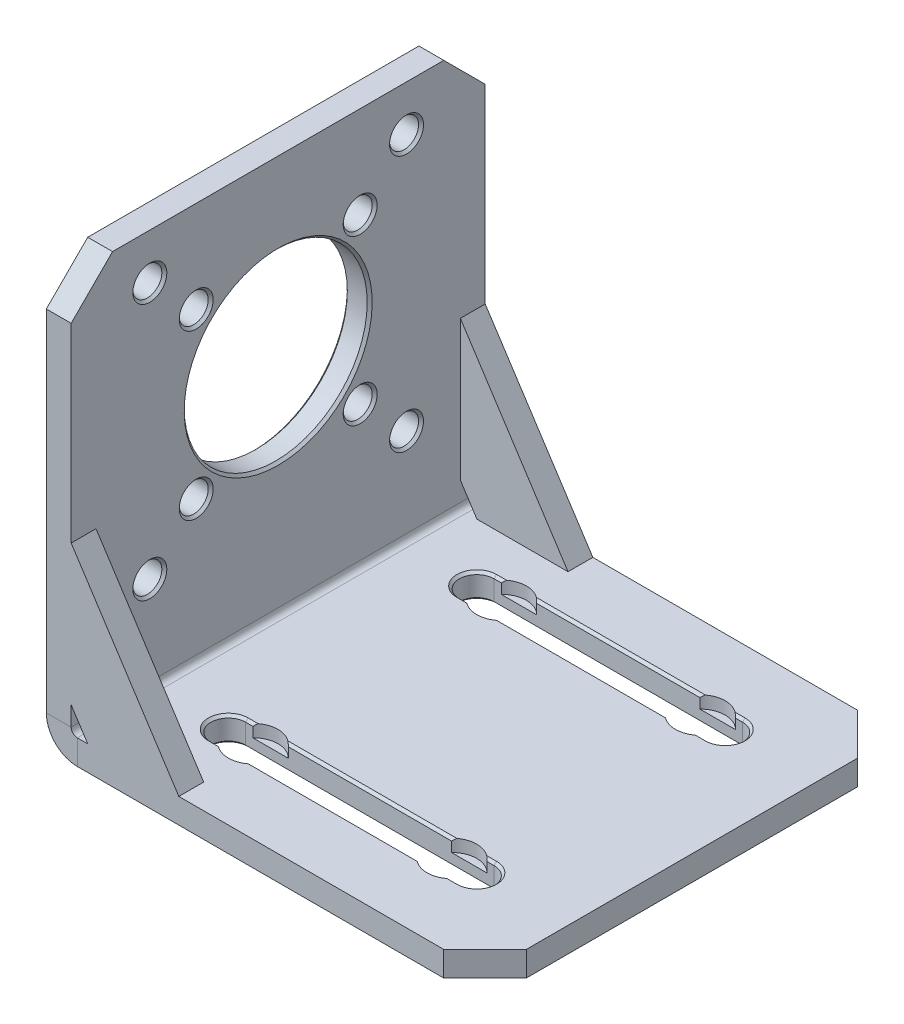
from build123d import *

# Parameters (mm, degrees)
SKETCH1_W                    = 100
SKETCH1_H                    = 50
BASE_FLANGE1_DEPTH           = 3
SKETCH2_R                    = 11.05
SKETCH2_R_2                  = 1.75
CUT_EXTRUDE1_DEPTH           = 104.121287812
SKETCH3_R                    = 1.75
CUT_EXTRUDE2_DEPTH           = 104.121287812
CIRPATTERN1_COUNT            = 4
CUT_EXTRUDE3_DEPTH           = 104.121287812
SKETCHED_BEND2_OUTLINE_W     = 3
SKETCHED_BEND2_OUTLINE_H     = 50
SKETCHED_BEND2_DEPTH         = 47.020021532
SKETCHED_START               = 47.383443248
SKETCHED_BEND2_2_OUTLINE_W   = 47.979978468
SKETCHED_BEND2_2_OUTLINE_H   = 50
SKETCHED_BEND2_2_OUTLINE_R   = 1.75
SKETCHED_BEND2_2_OUTLINE_R_2 = 11.05
SKETCHED_BEND2_2_DEPTH       = 2.636578284
SKETCHED_START_2             = 47.020021532
SKETCHED_BEND2_3_OUTLINE_W   = 47.979978468
SKETCHED_BEND2_3_OUTLINE_H   = 50
SKETCHED_BEND2_3_OUTLINE_R   = 1.75
SKETCHED_BEND2_3_OUTLINE_R_2 = 11.05
SKETCHED_BEND2_3_DEPTH       = 3.7366
SKETCHED_START_3             = -26
SKETCHED_BEND2_4_DEPTH       = 52
BOSS_EXTRUDE1_DEPTH          = 3
CHAMFER1_SIZE                = 5
CHAMFER2_SIZE                = 0.3
CHAMFER3_SIZE                = 0.3
SKETCH7_R                    = 3
CUT_EXTRUDE4_DEPTH           = 1.5


with BuildPart() as part:
    # Base-Flange1: sheet metal written as solids
    # Sketch1 → Base-Flange1 (new body)
    with BuildSketch(Plane(origin=(0, 0, 0), x_dir=(1, 0, 0), z_dir=(0, 1, 0))):
        with Locations((50, 0)):
            Rectangle(SKETCH1_W, SKETCH1_H)
    extrude(amount=-BASE_FLANGE1_DEPTH)

    # Sketch2 → Cut-Extrude1 (cut, through all)
    with BuildSketch(Plane(origin=(0, 0, 0), x_dir=(1, 0, 0), z_dir=(0, 1, 0))):
        with Locations(Location((21, 0, 0), (0, 0, 270))):
            Circle(SKETCH2_R)
        with Locations(Location((5.5, 15.5, 0), (0, 0, 270))):
            Circle(SKETCH2_R_2)
        with Locations(Location((36.5, 15.5, 0), (0, 0, 270))):
            Circle(SKETCH2_R_2)
        with Locations(Location((36.5, -15.5, 0), (0, 0, 270))):
            Circle(SKETCH2_R_2)
        with Locations(Location((5.5, -15.5, 0), (0, 0, 270))):
            Circle(SKETCH2_R_2)
    extrude(amount=-CUT_EXTRUDE1_DEPTH, mode=Mode.SUBTRACT)

    # Sketch3 → Cut-Extrude2 (cut, through all)
    with BuildSketch(Plane(origin=(0, 0, 0), x_dir=(1, 0, 0), z_dir=(0, 1, 0))):
        with Locations(Location((11.100505063, 9.899494937, 0), (0, 0, 270))):
            Circle(SKETCH3_R)
    cut_extrude2 = extrude(amount=-CUT_EXTRUDE2_DEPTH, mode=Mode.SUBTRACT)

    # CirPattern1: Cut-Extrude2 ×4 about axis
    cirpattern1_axis = Axis((21, 0, 0), (0, 1, 0))
    for i in range(1, CIRPATTERN1_COUNT):
        add(cut_extrude2.rotate(cirpattern1_axis, i * 360 / CIRPATTERN1_COUNT), mode=Mode.SUBTRACT)

    # Sketch4 → Cut-Extrude3 (cut, through all)
    with BuildSketch(Plane(origin=(0, 0, 0), x_dir=(1, 0, 0), z_dir=(0, 1, 0))):
        with BuildLine():
            Line((59, 17.1), (89, 17.1))
            ThreePointArc((89, 17.1), (91.1, 15), (89, 12.9))
            Line((89, 12.9), (59, 12.9))
            ThreePointArc((59, 12.9), (56.9, 15), (59, 17.1))
        make_face()
        with BuildLine():
            Line((59, -12.9), (89, -12.9))
            ThreePointArc((89, -12.9), (91.1, -15), (89, -17.1))
            Line((89, -17.1), (59, -17.1))
            ThreePointArc((59, -17.1), (56.9, -15), (59, -12.9))
        make_face()
    extrude(amount=-CUT_EXTRUDE3_DEPTH, mode=Mode.SUBTRACT)

    # Sketched Bend2: read off the stored shape, not the designer's step
    # Sketched Bend2 outline → Sketched Bend2 (cut)
    with BuildSketch(Plane.YZ):
        with Locations((-1.5, 0)):
            Rectangle(SKETCHED_BEND2_OUTLINE_W, SKETCHED_BEND2_OUTLINE_H)
    extrude(amount=SKETCHED_BEND2_DEPTH, mode=Mode.SUBTRACT)

    # Sketched Bend2 2 outline → Sketched Bend2 2 (add)
    with BuildSketch(Plane.YZ.offset(SKETCHED_START)):
        with Locations((23.989989234, 0)):
            Rectangle(SKETCHED_BEND2_2_OUTLINE_W, SKETCHED_BEND2_2_OUTLINE_H)
        with Locations((11.479978468, -15.5)):
            Circle(SKETCHED_BEND2_2_OUTLINE_R, mode=Mode.SUBTRACT)
        with Locations((17.080483531, -9.899494937)):
            Circle(SKETCHED_BEND2_2_OUTLINE_R, mode=Mode.SUBTRACT)
        with Locations((42.479978468, -15.5)):
            Circle(SKETCHED_BEND2_2_OUTLINE_R, mode=Mode.SUBTRACT)
        with Locations((36.879473404, -9.899494937)):
            Circle(SKETCHED_BEND2_2_OUTLINE_R, mode=Mode.SUBTRACT)
        with Locations((17.080483531, 9.899494937)):
            Circle(SKETCHED_BEND2_2_OUTLINE_R, mode=Mode.SUBTRACT)
        with Locations((11.479978468, 15.5)):
            Circle(SKETCHED_BEND2_2_OUTLINE_R, mode=Mode.SUBTRACT)
        with Locations((26.979978468, 0)):
            Circle(SKETCHED_BEND2_2_OUTLINE_R_2, mode=Mode.SUBTRACT)
        with Locations((36.879473404, 9.899494937)):
            Circle(SKETCHED_BEND2_2_OUTLINE_R, mode=Mode.SUBTRACT)
        with Locations((42.479978468, 15.5)):
            Circle(SKETCHED_BEND2_2_OUTLINE_R, mode=Mode.SUBTRACT)
    extrude(amount=SKETCHED_BEND2_2_DEPTH)

    # Sketched Bend2 3 outline → Sketched Bend2 3 (add)
    with BuildSketch(Plane.YZ.offset(SKETCHED_START_2)):
        with Locations((23.989989234, 0)):
            Rectangle(SKETCHED_BEND2_3_OUTLINE_W, SKETCHED_BEND2_3_OUTLINE_H)
        with Locations((11.479978468, -15.5)):
            Circle(SKETCHED_BEND2_3_OUTLINE_R, mode=Mode.SUBTRACT)
        with Locations((17.080483531, -9.899494937)):
            Circle(SKETCHED_BEND2_3_OUTLINE_R, mode=Mode.SUBTRACT)
        with Locations((42.479978468, -15.5)):
            Circle(SKETCHED_BEND2_3_OUTLINE_R, mode=Mode.SUBTRACT)
        with Locations((36.879473404, -9.899494937)):
            Circle(SKETCHED_BEND2_3_OUTLINE_R, mode=Mode.SUBTRACT)
        with Locations((17.080483531, 9.899494937)):
            Circle(SKETCHED_BEND2_3_OUTLINE_R, mode=Mode.SUBTRACT)
        with Locations((11.479978468, 15.5)):
            Circle(SKETCHED_BEND2_3_OUTLINE_R, mode=Mode.SUBTRACT)
        with Locations((26.979978468, 0)):
            Circle(SKETCHED_BEND2_3_OUTLINE_R_2, mode=Mode.SUBTRACT)
        with Locations((36.879473404, 9.899494937)):
            Circle(SKETCHED_BEND2_3_OUTLINE_R, mode=Mode.SUBTRACT)
        with Locations((42.479978468, 15.5)):
            Circle(SKETCHED_BEND2_3_OUTLINE_R, mode=Mode.SUBTRACT)
    extrude(amount=SKETCHED_BEND2_3_DEPTH)

    # Sketched Bend2 4 outline → Sketched Bend2 4 (cut)
    with BuildSketch(Plane.XY.offset(SKETCHED_START_3)):
        with BuildLine():
            Line((50.756621532, 47.979978468), (50.020021532, 47.979978468))
            Line((50.020021532, 47.979978468), (50.020021532, 0.7366))
            ThreePointArc((50.020021532, 0.7366), (50.235766677, 0.215745145), (50.756621532, 0))
            Line((50.756621532, 0), (50.756621532, 47.979978468))
        make_face()
        with BuildLine():
            ThreePointArc((50.756621532, -3), (48.114446333, -1.905575198), (47.020021532, 0.7366))
            Line((47.020021532, 0.7366), (47.020021532, -3))
            Line((47.020021532, -3), (50.756621532, -3))
        make_face()
    extrude(amount=SKETCHED_BEND2_4_DEPTH, mode=Mode.SUBTRACT)

    # Sketch6 → Boss-Extrude1 (add)
    with BuildSketch(Plane.XY.offset(25)):
        Polygon((50.020021532, 20), (63.020021532, 0), (52.020021532, 0), (50.020021532, 3.076923077), align=None)
    boss_extrude1 = extrude(amount=-BOSS_EXTRUDE1_DEPTH)

    # Mirror1: Boss-Extrude1 across plane
    add(boss_extrude1.mirror(Plane.XY))

    # Chamfer1
    chamfer1_edges = [part.edges().sort_by_distance(p)[0] for p in [
        (100, -1.5, -25),
        (100, -1.5, 25),
        (48.520021532, 47.979978468, -25),
        (48.520021532, 47.979978468, 25),
    ]]
    chamfer(chamfer1_edges, length=CHAMFER1_SIZE)

    # Chamfer2
    chamfer2_edges = [part.edges().sort_by_distance(p)[0] for p in [
        (74, 0, -17.1),
        (91.1, 0, -15),
        (74, 0, -12.9),
        (56.9, 0, -15),
        (74, 0, 12.9),
        (91.1, 0, 15),
        (74, 0, 17.1),
        (56.9, 0, 15),
        (56.9, -3, 15),
        (74, -3, 17.1),
        (91.1, -3, 15),
        (74, -3, 12.9),
        (56.9, -3, -15),
        (74, -3, -12.9),
        (91.1, -3, -15),
        (74, -3, -17.1),
        (47.020021532, 15.929978468, 0),
        (50.020021532, 15.929978468, 0),
        (47.020021532, 40.729978468, -15.5),
        (50.020021532, 40.729978468, -15.5),
        (47.020021532, 9.729978468, -15.5),
        (50.020021532, 9.729978468, -15.5),
        (47.020021532, 9.729978468, 15.5),
        (50.020021532, 9.729978468, 15.5),
        (47.020021532, 40.729978468, 15.5),
        (50.020021532, 40.729978468, 15.5),
    ]]
    chamfer(chamfer2_edges, length=CHAMFER2_SIZE)

    # Chamfer3
    chamfer3_edges = [part.edges().sort_by_distance(p)[0] for p in [
        (47.020021532, 35.129473404, -9.899494937),
        (50.020021532, 35.129473404, -9.899494937),
        (47.020021532, 35.129473404, 9.899494937),
        (50.020021532, 35.129473404, 9.899494937),
        (47.020021532, 15.330483531, 9.899494937),
        (50.020021532, 15.330483531, 9.899494937),
        (47.020021532, 15.330483531, -9.899494937),
        (50.020021532, 15.330483531, -9.899494937),
    ]]
    chamfer(chamfer3_edges, length=CHAMFER3_SIZE)

    # Sketch7 → Cut-Extrude4 (cut)
    with BuildSketch(Plane(origin=(0, 0, 0), x_dir=(1, 0, 0), z_dir=(0, 1, 0))):
        with Locations((86, -15)):
            Circle(SKETCH7_R)
        with Locations((62, -15)):
            Circle(SKETCH7_R)
        with Locations((86, 15)):
            Circle(SKETCH7_R)
        with Locations((62, 15)):
            Circle(SKETCH7_R)
    extrude(amount=-CUT_EXTRUDE4_DEPTH, mode=Mode.SUBTRACT)


solid = part.part
